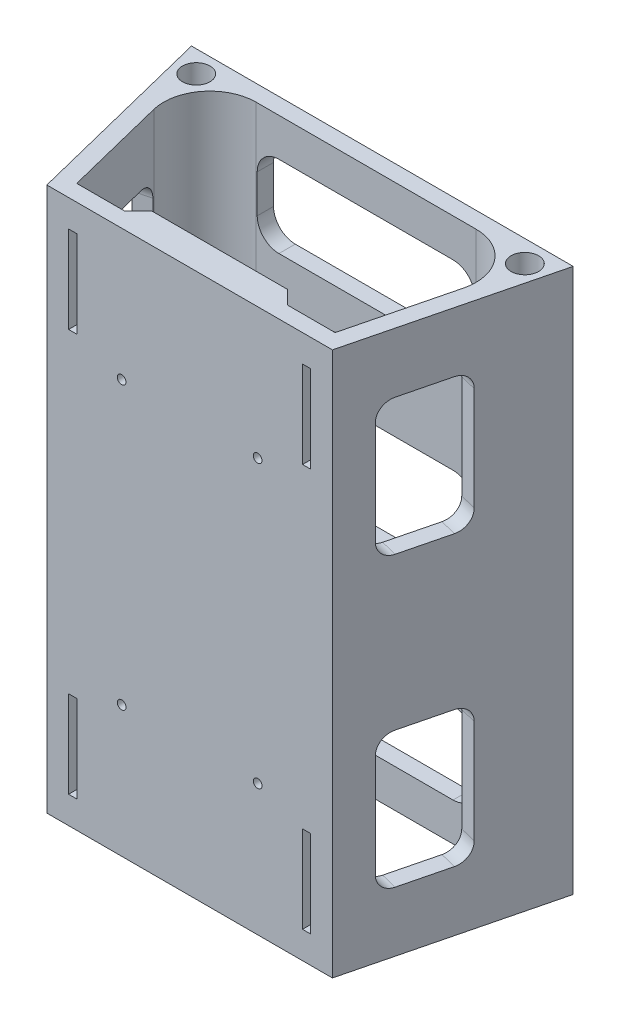
from build123d import *

# Parameters (mm, degrees)
BOSS_EXTRUDE2_DEPTH = 200
FILLET2_R           = 17
SKETCH3_R           = 5.05
CUT_EXTRUDE1_DEPTH  = 200
SKETCH4_R           = 1.3
CUT_EXTRUDE3_DEPTH  = 35
SKETCH5_W           = 80
SKETCH5_H           = 38
SKETCH5_H_2         = 30
CUT_EXTRUDE4_DEPTH  = 21
FILLET3_R           = 8
SKETCH6_W           = 3
SKETCH6_H           = 32
CUT_EXTRUDE5_DEPTH  = 21
SKETCH8_W           = 30
SKETCH8_H           = 50
CUT_EXTRUDE6_DEPTH  = 21
FILLET4_R           = 6
SKETCH9_W           = 30
SKETCH9_H           = 50
CUT_EXTRUDE7_DEPTH  = 21
FILLET5_R           = 6
SKETCH10_W          = 60
SKETCH10_H          = 2.25
BOSS_EXTRUDE3_DEPTH = 5
CHAMFER1_SIZE       = 5
CHAMFER2_SIZE       = 5
FILLET6_R           = 1
SKETCH11_W          = 60
SKETCH11_H          = 2.25
BOSS_EXTRUDE4_DEPTH = 5
CHAMFER3_SIZE       = 5
FILLET7_R           = 1
SKETCH12_R          = 1.6
CUT_EXTRUDE9_DEPTH  = 21
SKETCH13_R          = 3
CUT_EXTRUDE10_DEPTH = 2


with BuildPart() as part:
    # Sketch1 → Boss-Extrude2 (new body)
    with BuildSketch(Plane(origin=(0, 0, 0), x_dir=(1, 0, 0), z_dir=(0, 1, 0))):
        Polygon((-67.942807508, 35.802956243), (72.381423465, 35.802956243), (54.719307979, -35.035919795), (-50.280692021, -35.035919795), align=None)
        Polygon((-45.280692021, -29.035919795), (49.719307979, -29.035919795), (64.389487431, 29.802956243), (-59.950871474, 29.802956243), align=None, mode=Mode.SUBTRACT)
    extrude(amount=BOSS_EXTRUDE2_DEPTH)

    # Fillet2
    fillet2_edges = [part.edges().sort_by_distance(p)[0] for p in [
        (64.389487431, 100, -29.802956243),
        (-59.950871474, 100, -29.802956243),
    ]]
    fillet(fillet2_edges, radius=FILLET2_R)

    # Sketch3 → Cut-Extrude1 (cut)
    with BuildSketch(Plane(origin=(0, 200, 0), x_dir=(1, 0, 0), z_dir=(0, 1, 0))):
        with Locations(Location((-58.192807508, 27.802956243, 0), (0, 0, 270))):
            Circle(SKETCH3_R)
        with Locations(Location((62.631423465, 27.802956243, 0), (0, 0, 270))):
            Circle(SKETCH3_R)
    extrude(amount=-CUT_EXTRUDE1_DEPTH, mode=Mode.SUBTRACT)

    # Sketch4 → Cut-Extrude3 (cut)
    with BuildSketch(Plane(origin=(0, 0, -35.802956243), x_dir=(-1, 0, 0), z_dir=(0, 0, -1))):
        with Locations((9.092807508, 60)):
            Circle(SKETCH4_R)
        with Locations((-13.527192492, 60)):
            Circle(SKETCH4_R)
        with Locations((9.092807508, 140)):
            Circle(SKETCH4_R)
        with Locations((-2.217192492, 140)):
            Circle(SKETCH4_R)
        with Locations((-13.527192492, 140)):
            Circle(SKETCH4_R)
        with Locations((-2.217192492, 60)):
            Circle(SKETCH4_R)
    extrude(amount=-CUT_EXTRUDE3_DEPTH, mode=Mode.SUBTRACT)

    # Sketch5 → Cut-Extrude4 (cut)
    with BuildSketch(Plane(origin=(0, 0, -35.802956243), x_dir=(-1, 0, 0), z_dir=(0, 0, -1))):
        with Locations((-2.217192492, 100)):
            Rectangle(SKETCH5_W, SKETCH5_H)
        with Locations((-2.217192492, 171)):
            Rectangle(SKETCH5_W, SKETCH5_H_2)
        with Locations((-2.217192492, 29)):
            Rectangle(SKETCH5_W, SKETCH5_H_2)
    extrude(amount=-CUT_EXTRUDE4_DEPTH, mode=Mode.SUBTRACT)

    # Fillet3
    fillet3_edges = [part.edges().sort_by_distance(p)[0] for p in [
        (-37.782807508, 186, -32.802956243),
        (-37.782807508, 156, -32.802956243),
        (42.217192492, 156, -32.802956243),
        (42.217192492, 186, -32.802956243),
        (-37.782807508, 119, -32.802956243),
        (-37.782807508, 81, -32.802956243),
        (42.217192492, 81, -32.802956243),
        (42.217192492, 119, -32.802956243),
        (-37.782807508, 44, -32.802956243),
        (-37.782807508, 14, -32.802956243),
        (42.217192492, 14, -32.802956243),
        (42.217192492, 44, -32.802956243),
    ]]
    fillet(fillet3_edges, radius=FILLET3_R)

    # Sketch6 → Cut-Extrude5 (cut)
    with BuildSketch(Plane.XY.offset(35.035919795)):
        with Locations((-40.780692021, 174)):
            Rectangle(SKETCH6_W, SKETCH6_H)
        with Locations((-40.780692021, 26)):
            Rectangle(SKETCH6_W, SKETCH6_H)
        with Locations((45.219307979, 26)):
            Rectangle(SKETCH6_W, SKETCH6_H)
        with Locations((45.219307979, 174)):
            Rectangle(SKETCH6_W, SKETCH6_H)
    extrude(amount=-CUT_EXTRUDE5_DEPTH, mode=Mode.SUBTRACT)

    # Sketch8 → Cut-Extrude6 (cut)
    with BuildSketch(Plane(origin=(59.740978631, 0, 14.89509889), x_dir=(0.24192189559966498, 0, -0.9702957262759973), z_dir=(0.9702957262759971, 0, 0.24192189559966495))):
        with Locations((7.250106602, 47)):
            Rectangle(SKETCH8_W, SKETCH8_H)
        with Locations((7.250106602, 153)):
            Rectangle(SKETCH8_W, SKETCH8_H)
    extrude(amount=-CUT_EXTRUDE6_DEPTH, mode=Mode.SUBTRACT)

    # Fillet4
    fillet4_edges = [part.edges().sort_by_distance(p)[0] for p in [
        (62.065874762, 72, -7.456502519),
        (62.065874762, 22, -7.456502519),
        (54.808217894, 22, 21.652369269),
        (54.808217894, 72, 21.652369269),
        (62.065874762, 178, -7.456502519),
        (62.065874762, 128, -7.456502519),
        (54.808217894, 128, 21.652369269),
        (54.808217894, 178, 21.652369269),
    ]]
    fillet(fillet4_edges, radius=FILLET4_R)

    # Sketch9 → Cut-Extrude7 (cut)
    with BuildSketch(Plane(origin=(-55.562138014, 0, 13.853196905), x_dir=(0.2419218955996648, 0, 0.9702957262759973), z_dir=(-0.9702957262759973, 0, 0.2419218955996648))):
        with Locations((-6.176308215, 47)):
            Rectangle(SKETCH9_W, SKETCH9_H)
        with Locations((-6.176308215, 153)):
            Rectangle(SKETCH9_W, SKETCH9_H)
    extrude(amount=-CUT_EXTRUDE7_DEPTH, mode=Mode.SUBTRACT)

    # Fillet5
    fillet5_edges = [part.edges().sort_by_distance(p)[0] for p in [
        (-50.369601937, 72, 21.652369269),
        (-50.369601937, 22, 21.652369269),
        (-57.627258805, 22, -7.456502519),
        (-57.627258805, 72, -7.456502519),
        (-57.627258805, 128, -7.456502519),
        (-57.627258805, 178, -7.456502519),
        (-50.369601937, 178, 21.652369269),
        (-50.369601937, 128, 21.652369269),
    ]]
    fillet(fillet5_edges, radius=FILLET5_R)

    # Sketch10 → Boss-Extrude3 (add)
    with BuildSketch(Plane(origin=(0, 0, 29.035919795), x_dir=(-1, 0, 0), z_dir=(0, 0, -1))):
        with Locations((-2.219307979, 1.125)):
            Rectangle(SKETCH10_W, SKETCH10_H)
    extrude(amount=BOSS_EXTRUDE3_DEPTH)

    # Chamfer1
    chamfer1_edges = [part.edges().sort_by_distance(p)[0] for p in [
        (32.219307979, 1.125, 24.035919795),
    ]]
    chamfer(chamfer1_edges, length=CHAMFER1_SIZE - 0.0001)  # a hair under: the kernel refuses the full size

    # Chamfer2
    chamfer2_edges = [part.edges().sort_by_distance(p)[0] for p in [
        (-27.780692021, 1.125, 24.035919795),
    ]]
    chamfer(chamfer2_edges, length=CHAMFER2_SIZE - 0.0001)  # a hair under: the kernel refuses the full size

    # Fillet6
    fillet6_edges = [part.edges().sort_by_distance(p)[0] for p in [
        (2.219307979, 2.25, 29.035919795),
    ]]
    fillet(fillet6_edges, radius=FILLET6_R)

    # Sketch11 → Boss-Extrude4 (add)
    with BuildSketch(Plane(origin=(0, 0, 29.035919795), x_dir=(-1, 0, 0), z_dir=(0, 0, -1))):
        with Locations((-2.219307979, 198.875)):
            Rectangle(SKETCH11_W, SKETCH11_H)
    extrude(amount=BOSS_EXTRUDE4_DEPTH)

    # Chamfer3
    chamfer3_edges = [part.edges().sort_by_distance(p)[0] for p in [
        (32.219307979, 198.875, 24.035919795),
        (-27.780692021, 198.875, 24.035919795),
    ]]
    chamfer(chamfer3_edges, length=CHAMFER3_SIZE - 0.0001)  # a hair under: the kernel refuses the full size

    # Fillet7
    fillet7_edges = [part.edges().sort_by_distance(p)[0] for p in [
        (2.219307979, 197.75, 29.035919795),
    ]]
    fillet(fillet7_edges, radius=FILLET7_R)

    # Sketch12 → Cut-Extrude9 (cut)
    with BuildSketch(Plane.XY.offset(35.035919795)):
        with Locations((27.219307979, 48.22)):
            Circle(SKETCH12_R)
        with Locations((-22.780692021, 48.22)):
            Circle(SKETCH12_R)
        with Locations((27.219307979, 151.78)):
            Circle(SKETCH12_R)
        with Locations((-22.780692021, 151.78)):
            Circle(SKETCH12_R)
    extrude(amount=-CUT_EXTRUDE9_DEPTH, mode=Mode.SUBTRACT)

    # Sketch13 → Cut-Extrude10 (cut)
    with BuildSketch(Plane(origin=(0, 0, 29.035919795), x_dir=(-1, 0, 0), z_dir=(0, 0, -1))):
        with Locations((-27.219307979, 48.22)):
            Circle(SKETCH13_R)
        with Locations((22.780692021, 48.22)):
            Circle(SKETCH13_R)
        with Locations((-27.219307979, 151.78)):
            Circle(SKETCH13_R)
        with Locations((22.780692021, 151.78)):
            Circle(SKETCH13_R)
    extrude(amount=-CUT_EXTRUDE10_DEPTH, mode=Mode.SUBTRACT)


solid = part.part
